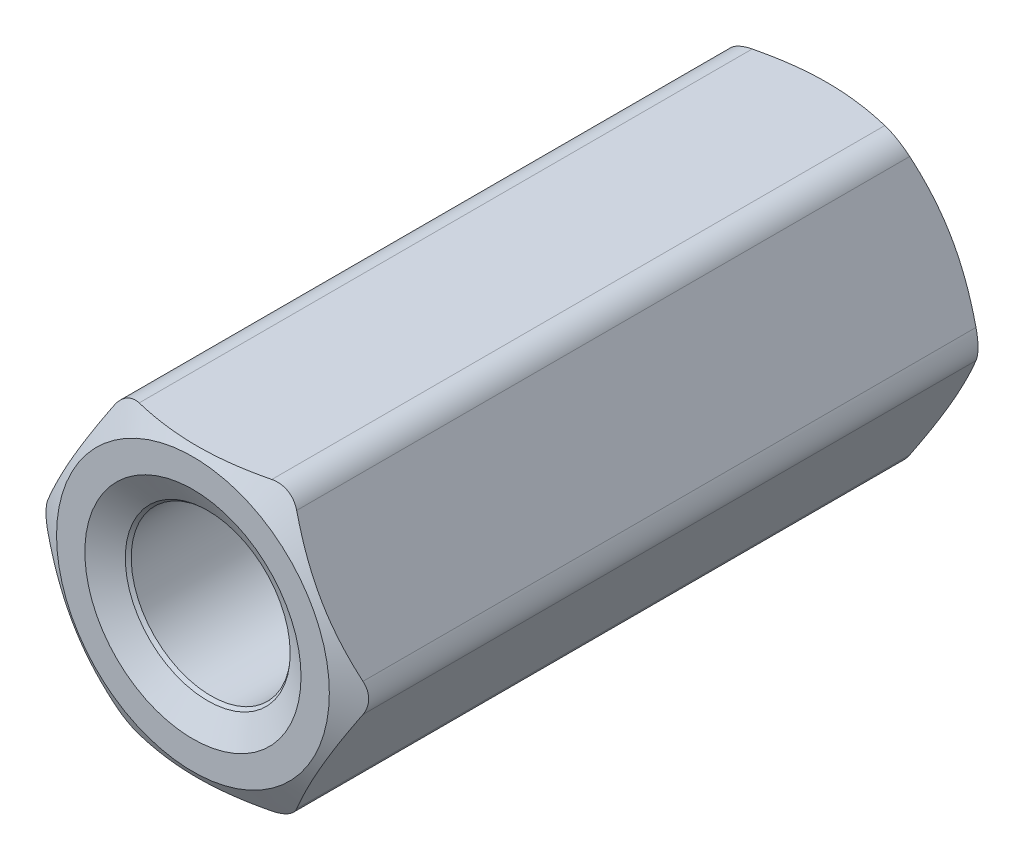
from build123d import *

# Parameters (mm, degrees)
SKETCH4_R           = 1.75
BOSS_EXTRUDE1_DEPTH = 5
SKETCH5_OUTSIDE_W   = 49.716
SKETCH5_OUTSIDE_H   = 49.02
SKETCH5_OUTSIDE_R   = 2.1375
CUT_EXTRUDE1_DEPTH  = 11.574142991
CUT_EXTRUDE1_DRAFT  = -60
SKETCH6_OUTSIDE_W   = 49.716
SKETCH6_OUTSIDE_H   = 49.02
SKETCH6_OUTSIDE_R   = 2.1375
CUT_EXTRUDE2_DEPTH  = 11.574142991
CUT_EXTRUDE2_DRAFT  = -60
FILLET1_R           = 0.45
BOSS_EXTRUDE2_START = -5
SKETCH7_R           = 1.69375
BOSS_EXTRUDE2_DEPTH = 4.8
SKETCH8_W           = 4.8
SKETCH8_H           = 1.25
CIRPATTERN1_COUNT   = 2


with BuildPart() as part:
    # Sketch3 → Revolve1 (revolve)
    with BuildSketch(Plane(origin=(0, 0, 0), x_dir=(0, 0, -1), z_dir=(1, 0, 0))):
        Polygon((-4.743800818, 1.25), (-0.2, 1.25), (-0.2, 0), (0.2, 0), (0.2, 1.25), (4.743800818, 1.25), (5, 1.69375), (5, 2.25), (0, 2.25), (-5, 2.25), (-5, 1.69375), align=None)
        Polygon((-4.743800818, 1.25), (-0.2, 1.25), (-0.2, 0), (0.2, 0), (0.2, 1.25), (4.743800818, 1.25), (5, 1.69375), (5, 2.25), (0, 2.25), (-5, 2.25), (-5, 1.69375), align=None)
    revolve(axis=Axis((0, 0, 0.2), (0, 0, 1)))

    # Sketch4 → Boss-Extrude1 (add, symmetric)
    with BuildSketch(Plane.XY):
        Polygon((-1.299038106, 2.25), (-2.598076211, 0), (-1.299038106, -2.25), (1.299038106, -2.25), (2.598076211, 0), (1.299038106, 2.25), align=None)
        Circle(SKETCH4_R, mode=Mode.SUBTRACT)
    extrude(amount=BOSS_EXTRUDE1_DEPTH, both=True)


with BuildPart() as cut_extrude1_tool:
    # Sketch5 outside → Cut-Extrude1 (with draft: the straight prism first)
    with BuildSketch(Plane.XY.offset(5)):
        Rectangle(SKETCH5_OUTSIDE_W, SKETCH5_OUTSIDE_H)
        Circle(SKETCH5_OUTSIDE_R, mode=Mode.SUBTRACT)
    extrude(amount=-CUT_EXTRUDE1_DEPTH)
    # Cut-Extrude1: the draft: its side faces are tilted about the plane it starts from
    cut_extrude1_sides = [cut_extrude1_tool.faces().sort_by_distance(p)[0] for p in [
        (0, -24.51, -0.787071496),
        (24.858, 0, -0.787071496),
        (0, 24.51, -0.787071496),
        (-24.858, 0, -0.787071496),
        (-2.1375, 0, -0.787071496),
    ]]
    draft(cut_extrude1_sides, Plane.XY.offset(5), CUT_EXTRUDE1_DRAFT)


with BuildPart() as part_1:
    add(part.part)

    # Cut-Extrude1: cut by cut_extrude1_tool
    add(cut_extrude1_tool.part, mode=Mode.SUBTRACT)


with BuildPart() as cut_extrude2_tool:
    # Sketch6 outside → Cut-Extrude2 (with draft: the straight prism first)
    with BuildSketch(Plane(origin=(0, 0, -5), x_dir=(-1, 0, 0), z_dir=(0, 0, -1))):
        Rectangle(SKETCH6_OUTSIDE_W, SKETCH6_OUTSIDE_H)
        Circle(SKETCH6_OUTSIDE_R, mode=Mode.SUBTRACT)
    extrude(amount=-CUT_EXTRUDE2_DEPTH)
    # Cut-Extrude2: the draft: its side faces are tilted about the plane it starts from
    cut_extrude2_sides = [cut_extrude2_tool.faces().sort_by_distance(p)[0] for p in [
        (0, -24.51, 0.787071496),
        (-24.858, 0, 0.787071496),
        (0, 24.51, 0.787071496),
        (24.858, 0, 0.787071496),
        (2.1375, 0, 0.787071496),
    ]]
    draft(cut_extrude2_sides, Plane(origin=(0, 0, -5), x_dir=(-1, 0, 0), z_dir=(0, 0, -1)), CUT_EXTRUDE2_DRAFT)


with BuildPart() as part_2:
    add(part_1.part)

    # Cut-Extrude2: cut by cut_extrude2_tool
    add(cut_extrude2_tool.part, mode=Mode.SUBTRACT)

    # Fillet1
    # the kernel refuses this fillet: 0.45 mm, written as the material it takes off along each edge
    with BuildSketch(Plane(origin=(1.299038106, 2.25, 5.383605253), x_dir=(-1, 0, 0), z_dir=(0, 0, -1)), Plane(origin=(-1.299038106, 2.25, 5.383605253), x_dir=(-0.49999999999999967, -0.8660254037844387, 0), z_dir=(0, 0, -1))) as fillet1_piece_1:
        with BuildLine():
            CenterArc((FILLET1_R * 0.57735026919, -FILLET1_R), FILLET1_R, 90, 60)
            Line((-FILLET1_R * 0.288675134595, -FILLET1_R * 0.5), (0, 0))
            Line((0, 0), (FILLET1_R * 0.57735026919, 0))
        make_face()
    extrude(amount=10.767210506, mode=Mode.SUBTRACT)
    with BuildSketch(Plane(origin=(-2.598076211, 0, -5.383605253), x_dir=(0.5000000000000006, -0.8660254037844384, 0), z_dir=(0, 0, 1)), Plane(origin=(-1.299038106, -2.25, -5.383605253), x_dir=(1, 0, 0), z_dir=(0, 0, 1)), Plane(origin=(1.299038106, -2.25, -5.383605253), x_dir=(0.49999999999999967, 0.8660254037844387, 0), z_dir=(0, 0, 1)), Plane(origin=(2.598076211, 0, 5.383605253), x_dir=(-0.5, -0.8660254037844388, 0), z_dir=(0, 0, -1))) as fillet1_piece_2:
        with BuildLine():
            CenterArc((FILLET1_R * 0.57735026919, FILLET1_R), FILLET1_R, 210, 60)
            Line((-FILLET1_R * 0.288675134595, FILLET1_R * 0.5), (0, 0))
            Line((0, 0), (FILLET1_R * 0.57735026919, 0))
        make_face()
    extrude(amount=10.767210506, mode=Mode.SUBTRACT)

    # Sketch7 → Boss-Extrude2 (add)
    with BuildSketch(Plane(origin=(0, 0, 0), x_dir=(-1, 0, 0), z_dir=(0, 0, -1)).offset(BOSS_EXTRUDE2_START)):
        Circle(SKETCH7_R)
    extrude(amount=BOSS_EXTRUDE2_DEPTH)

    # SurfaceCut1
    split(bisect_by=Plane.XY, keep=Keep.TOP)


with BuildPart() as body_2:
    # Sketch8 → Revolve2 (revolve)
    with BuildSketch(Plane(origin=(0, 0, 0), x_dir=(0, 0, -1), z_dir=(1, 0, 0))):
        with Locations((-2.6, 0.625)):
            Rectangle(SKETCH8_W, SKETCH8_H)
    revolve(axis=Axis((0, 0, 0.2), (0, 0, 1)))


with BuildPart() as part_3:
    add(part_2.part)

    # Combine1: cut body 2
    add(body_2.part, mode=Mode.SUBTRACT)

    # Cut-Extrude3 cone 1 section (through the dimple's axis) → Cut-Extrude3 (revolve, cut)
    with BuildSketch(Plane(origin=(0, 0, 5), x_dir=(0, -1, 0), z_dir=(1, 0, 0))):
        Polygon((0, 0), (1.69375, 0), (0, 0.977887018), align=None)
    revolve(axis=Axis((0, 0, 5), (0, 0, -1)), mode=Mode.SUBTRACT)

    # Cut-Extrude4 cone 1 section (through the dimple's axis) → Cut-Extrude4 (revolve, cut)
    with BuildSketch(Plane(origin=(0, 0, 4.768157783), x_dir=(0, -1, 0), z_dir=(1, 0, 0))):
        Polygon((0, 0), (1.3008, 0), (0, 1.3008), align=None)
    revolve(axis=Axis((0, 0, 4.768157783), (0, 0, -1)), mode=Mode.SUBTRACT)


with BuildPart() as cirpattern1_1:
    # CirPattern1: pattern copy
    add(part_3.part.rotate(Axis((0, 0, 0), (1, 0, 0)), 1 * 360 / CIRPATTERN1_COUNT))


with BuildPart() as part_4:
    add(part_3.part)

    # Combine2: union CirPattern1_1
    add(cirpattern1_1.part)


solid = part_4.part
